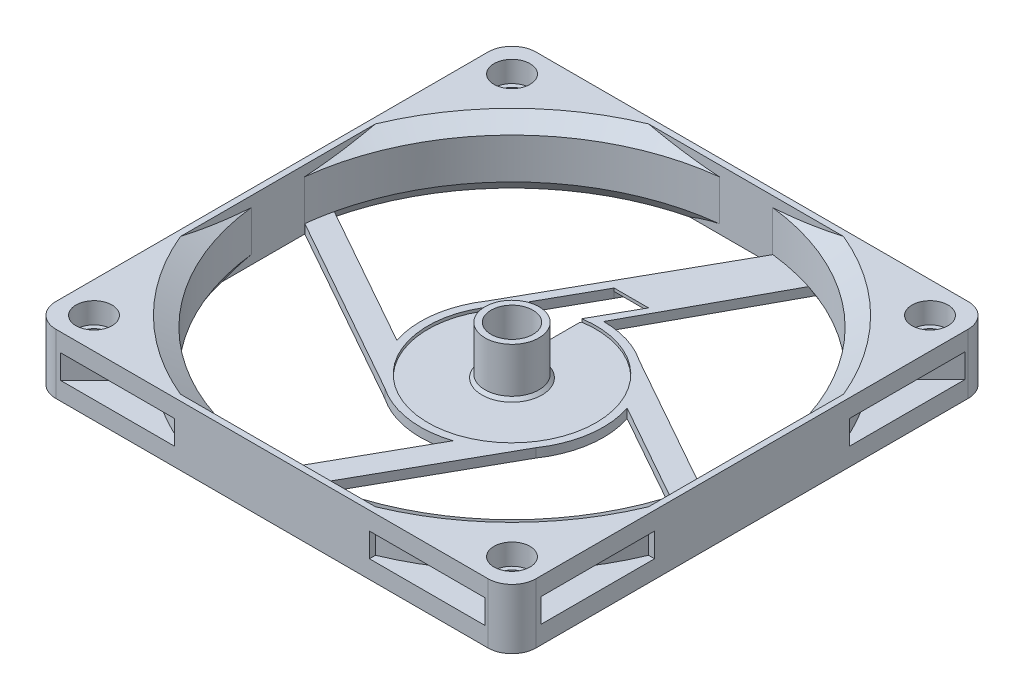
from build123d import *

# Parameters (mm, degrees)
SKETCH1_R            = 39.25
SKETCH1_R_2          = 2.25
BOSS_EXTRUDE1_DEPTH  = 10
SKETCH2_R            = 2.25
CUT_EXTRUDE1_DEPTH   = 10
SKETCH3_R            = 3
CUT_EXTRUDE2_DEPTH   = 3.5
CUT_EXTRUDE3_START   = -2.5
SKETCH4_R            = 3
CUT_EXTRUDE3_DEPTH   = 2.5
LPATTERN1_COUNT      = 2
LPATTERN1_PITCH      = 69.65
LPATTERN1_COUNT_DIR2 = 2
LPATTERN1_PITCH_DIR2 = 69.65
CHAMFER1_SIZE        = 3
CHAMFER1_SIZE_2      = 1.732050808
BOSS_EXTRUDE3_REACH  = 59.446
SKETCH5_W            = 1
SKETCH5_H            = 43.997245161
CIRPATTERN1_COUNT    = 4
SKETCH6_R            = 3.4
BOSS_EXTRUDE4_DEPTH  = 1.5
SKETCH7_R            = 4.5
BOSS_EXTRUDE5_DEPTH  = 7.5
SKETCH8_R            = 3.5
CUT_EXTRUDE4_DEPTH   = 20
CUT_EXTRUDE5_DEPTH   = 5
CUT_EXTRUDE6_DEPTH   = 1
CUT_EXTRUDE8_DEPTH   = 2
CIRPATTERN2_COUNT    = 4
SKETCH13_R           = 14
SKETCH13_R_2         = 5
CUT_EXTRUDE9_DEPTH   = 0.5
CHAMFER3_SIZE        = 0.5
CHAMFER5_SIZE        = 1.5
CHAMFER5_SIZE2       = 0.866025404
CHAMFER6_SIZE        = 1.5
CHAMFER6_SIZE2       = 0.866025404
CHAMFER7_SIZE        = 1.5
CHAMFER7_SIZE2       = 0.866025404
CHAMFER8_SIZE        = 1.5
CHAMFER8_SIZE2       = 0.866025404


# Some blends are built 0.0001 mm under size
with BuildPart() as part:
    # Sketch1 → Boss-Extrude1 (new body)
    with BuildSketch(Plane(origin=(0, 0, 0), x_dir=(1, 0, 0), z_dir=(0, 1, 0))):
        with BuildLine():
            Line((-36, 40), (36, 40))
            ThreePointArc((36, 40), (38.828427125, 38.828427125), (40, 36))
            Line((40, 36), (40, -36))
            ThreePointArc((40, -36), (38.828427125, -38.828427125), (36, -40))
            Line((36, -40), (-36, -40))
            ThreePointArc((-36, -40), (-38.828427125, -38.828427125), (-40, -36))
            Line((-40, -36), (-40, 36))
            ThreePointArc((-40, 36), (-38.828427125, 38.828427125), (-36, 40))
        make_face()
        with Locations(Location((0, 0, 0), (0, 0, 270))):
            Circle(SKETCH1_R, mode=Mode.SUBTRACT)
        with Locations(Location((-34.825008973, 34.825008973, 0), (0, 0, 270))):
            Circle(SKETCH1_R_2, mode=Mode.SUBTRACT)
        with Locations(Location((34.825008973, -34.825008973, 0), (0, 0, 270))):
            Circle(SKETCH1_R_2, mode=Mode.SUBTRACT)
    extrude(amount=BOSS_EXTRUDE1_DEPTH)

    # Sketch2 → Cut-Extrude1 (cut)
    with BuildSketch(Plane(origin=(0, 10, 0), x_dir=(1, 0, 0), z_dir=(0, 1, 0))):
        with Locations(Location((-34.825008973, -34.825008973, 0), (0, 0, 270))):
            Circle(SKETCH2_R)
        with Locations(Location((34.825008973, 34.825008973, 0), (0, 0, 270))):
            Circle(SKETCH2_R)
    extrude(amount=-CUT_EXTRUDE1_DEPTH, mode=Mode.SUBTRACT)

    # Sketch3 → Cut-Extrude2 (cut)
    with BuildSketch(Plane(origin=(0, 10, 0), x_dir=(1, 0, 0), z_dir=(0, 1, 0))):
        with Locations(Location((-34.825008973, -34.825008973, 0), (0, 0, 270))):
            Circle(SKETCH3_R)
    cut_extrude2 = extrude(amount=-CUT_EXTRUDE2_DEPTH, mode=Mode.SUBTRACT)

    # Sketch4 → Cut-Extrude3 (cut)
    with BuildSketch(Plane.XZ.offset(CUT_EXTRUDE3_START)):
        with Locations(Location((-34.825008973, 34.825008973, 0), (0, 0, 90))):
            Circle(SKETCH4_R)
    cut_extrude3 = extrude(amount=CUT_EXTRUDE3_DEPTH, mode=Mode.SUBTRACT)

    # LPattern1: Cut-Extrude2, Cut-Extrude3 2 × 2
    with Locations(*[(i * LPATTERN1_PITCH, 0, -j * LPATTERN1_PITCH_DIR2) for i in range(LPATTERN1_COUNT) for j in range(LPATTERN1_COUNT_DIR2) if (i, j) != (0, 0)]):
        add(cut_extrude2, mode=Mode.SUBTRACT)
        add(cut_extrude3, mode=Mode.SUBTRACT)

    # Chamfer1
    # the kernel refuses this chamfer: 3, 1.732050808 mm, written as the material it takes off along each edge
    with BuildSketch(Plane(origin=(0, 10, 0), x_dir=(0, 0, 1), z_dir=(-1, 0, 0))) as chamfer1_piece_1:
        Polygon((39.25 + CHAMFER1_SIZE, 0), (39.25, -CHAMFER1_SIZE_2), (39.25, 0), align=None)
    revolve(axis=Axis((0, 10, 0), (0, 1, 0)), mode=Mode.SUBTRACT)

    # Boss-Extrude3: up to this face of the body (flat: up to its plane)
    boss_extrude3_end = Plane(part.part.faces().sort_by_distance((-39.886862915, 0, 0))[0])
    # Sketch5 → Boss-Extrude3 (add, up to the picked face)
    with BuildSketch(Plane(origin=(0, 10, 0), x_dir=(1, 0, 0), z_dir=(0, 1, 0)), mode=Mode.PRIVATE) as boss_extrude3_sk1:
        with Locations((-39.5, 2.80326135)):
            Rectangle(SKETCH5_W, SKETCH5_H)
    boss_extrude3_tool1 = split(extrude(boss_extrude3_sk1.sketch, amount=-BOSS_EXTRUDE3_REACH, mode=Mode.PRIVATE), bisect_by=boss_extrude3_end, keep=Keep.BOTH, mode=Mode.PRIVATE)
    boss_extrude3 = boss_extrude3_tool1.solids().sort_by(Axis((-39.5, 10, -2.803261), (0, -1, 0)))[0]
    add(boss_extrude3)

    # CirPattern1: Boss-Extrude3 ×4 about axis
    cirpattern1_axis = Axis((0, 0, 0), (0, 1, 0))
    for i in range(1, CIRPATTERN1_COUNT):
        add(boss_extrude3.rotate(cirpattern1_axis, i * 360 / CIRPATTERN1_COUNT))

    # Sketch6 → Boss-Extrude4 (add)
    with BuildSketch(Plane.XZ):
        with BuildLine():
            Line((-39.084728045, -4.524028813), (-8.585836736, 12.597738189))
            ThreePointArc((-8.585836736, 12.597738189), (-2.17093671, 15.089951416), (4.68635309, 14.507160116))
            Line((4.68635309, 14.507160116), (-8.709754121, 38.369558067))
            ThreePointArc((-8.709754121, 38.369558067), (-6.62654659, 38.78365227), (-4.524028813, 39.084728045))
            Line((-4.524028813, 39.084728045), (12.597738189, 8.585836736))
            ThreePointArc((12.597738189, 8.585836736), (15.089951416, 2.17093671), (14.507160116, -4.68635309))
            Line((14.507160116, -4.68635309), (38.369558067, 8.709754121))
            ThreePointArc((38.369558067, 8.709754121), (38.78365227, 6.62654659), (39.084728045, 4.524028813))
            Line((39.084728045, 4.524028813), (8.585836736, -12.597738189))
            ThreePointArc((8.585836736, -12.597738189), (4.503957114, -14.564819609), (0.024213364, -15.245294803))
            Line((0.024213364, -15.245294803), (12.097129034, -37.43984872))
            ThreePointArc((12.097129034, -37.43984872), (8.351175309, -38.449196013), (4.524028813, -39.084728045))
            Line((4.524028813, -39.084728045), (-12.597738189, -8.585836736))
            ThreePointArc((-12.597738189, -8.585836736), (-15.089951416, -2.17093671), (-14.507160116, 4.68635309))
            Line((-14.507160116, 4.68635309), (-38.369558067, -8.709754121))
            ThreePointArc((-38.369558067, -8.709754121), (-38.78365227, -6.62654659), (-39.084728045, -4.524028813))
        make_face()
        with Locations(Location((0, 0, 0), (0, 0, 270))):
            Circle(SKETCH6_R, mode=Mode.SUBTRACT)
    extrude(amount=-BOSS_EXTRUDE4_DEPTH)

    # Sketch7 → Boss-Extrude5 (add)
    with BuildSketch(Plane(origin=(0, 1.5, 0), x_dir=(1, 0, 0), z_dir=(0, 1, 0))):
        with Locations(Location((0, 0, 0), (0, 0, 270))):
            Circle(SKETCH7_R)
    extrude(amount=BOSS_EXTRUDE5_DEPTH)

    # Sketch8 → Cut-Extrude4 (cut)
    with BuildSketch(Plane(origin=(0, 9, 0), x_dir=(1, 0, 0), z_dir=(0, 1, 0))):
        with Locations(Location((0, 0, 0), (0, 0, 270))):
            Circle(SKETCH8_R)
    extrude(amount=-CUT_EXTRUDE4_DEPTH, mode=Mode.SUBTRACT)

    # Sketch9 → Cut-Extrude5 (cut)
    with BuildSketch(Plane(origin=(0, 1.5, 0), x_dir=(1, 0, 0), z_dir=(0, 1, 0))):
        Polygon((-3.935436061, 20.95174809), (-8.987944411, 11.95174809), (-8.987944411, 7.95174809), (-2.339350917, 7.95174809), (-2.339350917, 12.34983502), (-2.339350917, 13.580875309), (1.798582003, 20.95174809), align=None)
    extrude(amount=-CUT_EXTRUDE5_DEPTH, mode=Mode.SUBTRACT)

    # Sketch10 → Cut-Extrude6 (cut)
    with BuildSketch(Plane.XZ):
        Polygon((-3.935436061, -20.95174809), (6.530888691, -40), (12.264906755, -40), (1.798582003, -20.95174809), align=None)
    extrude(amount=-CUT_EXTRUDE6_DEPTH, mode=Mode.SUBTRACT)

    # Sketch12 → Cut-Extrude8 (cut, symmetric)
    with BuildSketch(Plane(origin=(0, 5, 0), x_dir=(-1, 0, 0), z_dir=(0, 1, 0))):
        with BuildLine():
            Line((32.562203938, -37.087687338), (27.526706936, -32.052190335))
            ThreePointArc((27.526706936, -32.052190335), (22.162311078, -35.970744608), (16.25, -39))
            Line((16.25, -39), (16.25, -40))
            Line((16.25, -40), (35.4745166, -40))
            Line((35.4745166, -40), (32.562203938, -37.087687338))
        make_face()
        with BuildLine():
            Line((37.075074104, -32.266747992), (32.182531883, -27.374205771))
            ThreePointArc((32.182531883, -27.374205771), (36.023259151, -22.07684987), (39, -16.25))
            Line((39, -16.25), (40, -16.25))
            Line((40, -16.25), (40, -35.191673888))
            Line((40, -35.191673888), (37.075074104, -32.266747992))
        make_face()
    cut_extrude8 = extrude(amount=CUT_EXTRUDE8_DEPTH, both=True, mode=Mode.SUBTRACT)

    # CirPattern2: Cut-Extrude8 ×4 about axis
    cirpattern2_axis = Axis((0, 0, 0), (0, 1, 0))
    for i in range(1, CIRPATTERN2_COUNT):
        add(cut_extrude8.rotate(cirpattern2_axis, i * 360 / CIRPATTERN2_COUNT), mode=Mode.SUBTRACT)

    # Sketch13 → Cut-Extrude9 (cut)
    with BuildSketch(Plane(origin=(0, 1.5, 0), x_dir=(1, 0, 0), z_dir=(0, 1, 0))):
        Circle(SKETCH13_R)
        with Locations(Location((0, 0, 0), (0, 0, 270))):
            Circle(SKETCH13_R_2, mode=Mode.SUBTRACT)
    extrude(amount=-CUT_EXTRUDE9_DEPTH, mode=Mode.SUBTRACT)

    # Chamfer3
    chamfer3_edges = [part.edges().sort_by_distance(p)[0] for p in [
        (0, 1.5, -5),
    ]]
    chamfer(chamfer3_edges, length=CHAMFER3_SIZE - 0.0001)  # a hair under: the kernel refuses the full size

    # Chamfer5
    chamfer5_edges = [part.edges().sort_by_distance(p)[0] for p in [
        (30.375317163, 0, -24.857646857),
    ]]
    chamfer5_side = [part.faces().sort_by_distance(p)[0] for p in [
        (27.753941162, 4.133974596, -27.753941162),
    ]]
    chamfer(chamfer5_edges, length=CHAMFER5_SIZE, length2=CHAMFER5_SIZE2, reference=chamfer5_side[0])

    # Chamfer6
    chamfer6_edges = [part.edges().sort_by_distance(p)[0] for p in [
        (-26.192646148, 0, -29.231965171),
    ]]
    chamfer6_side = [part.faces().sort_by_distance(p)[0] for p in [
        (-27.753941162, 4.133974896, -27.753941162),
    ]]
    chamfer(chamfer6_edges, length=CHAMFER6_SIZE, length2=CHAMFER6_SIZE2, reference=chamfer6_side[0])

    # Chamfer7
    chamfer7_edges = [part.edges().sort_by_distance(p)[0] for p in [
        (-29.231965171, 0, 26.192646148),
    ]]
    chamfer7_side = [part.faces().sort_by_distance(p)[0] for p in [
        (-27.753941162, 4.133974896, 27.753941162),
    ]]
    chamfer(chamfer7_edges, length=CHAMFER7_SIZE, length2=CHAMFER7_SIZE2, reference=chamfer7_side[0])

    # Chamfer8
    chamfer8_edges = [part.edges().sort_by_distance(p)[0] for p in [
        (26.192646148, 0, 29.231965171),
    ]]
    chamfer8_side = [part.faces().sort_by_distance(p)[0] for p in [
        (27.753941162, 4.133974596, 27.753941162),
    ]]
    chamfer(chamfer8_edges, length=CHAMFER8_SIZE, length2=CHAMFER8_SIZE2, reference=chamfer8_side[0])


solid = part.part
